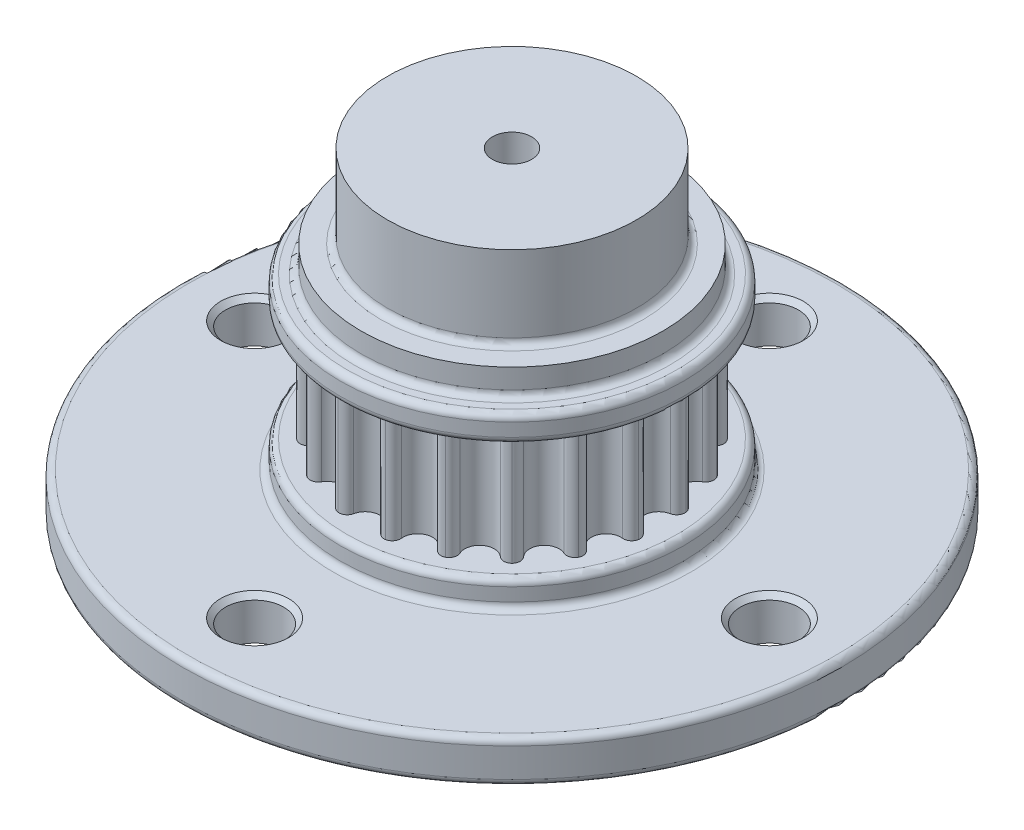
from build123d import *

# Parameters (mm, degrees)
BOSS_EXTRUDE1_DEPTH     = 3.556
CIRPATTERN1_COUNT       = 20
SKETCH9_R               = 19.84375
SKETCH9_R_2             = 1.4999999999999996
BOSS_EXTRUDE2_DEPTH     = 2.54
CUT_EXTRUDE1_DEPTH      = 30.081395842465593
CUT_EXTRUDE1_DEPTH_BACK = 30.081395842465593
SKETCH3_R               = 1.7462499999999996
SKETCH3_R_2             = 1.746249999999999
SKETCH3_R_3             = 1.7462500000000012
SKETCH3_R_4             = 1.7462499999999985
CIRPATTERN2_COUNT       = 4
CUT_EXTRUDE2_START      = -6
SKETCH11_R              = 1.5
CUT_EXTRUDE2_DEPTH      = 6
FILLET1_R               = 0.396875


with BuildPart() as part:
    # Sketch1 → Boss-Extrude1 (new, symmetric)
    with BuildSketch(Plane(origin=(0, 0, 0), x_dir=(1, 0, 0), z_dir=(0, 1, 0))):
        with BuildLine():
            ThreePointArc((0.8720606070123648, 8.659786465382457), (0.5629673031092283, 8.148255135369217), (0, 7.947579307894175))
            ThreePointArc((0, 7.947579307894175), (-1.2432753173952258, -7.8497314183622535), (2.4559370702819923, 7.558597089545281))
            ThreePointArc((2.4559370702819887, 7.558597089545281), (1.982535589248892, 7.923417606866525), (1.8466422625579257, 8.505427895318311))
            ThreePointArc((1.846642262557925, 8.505427895318311), (1.749626992044169, 8.862101959434877), (1.4341191216417435, 9.054671776489402))
            ThreePointArc((1.4341191216417435, 9.054671776489402), (1.0745459594794837, 8.96902429095141), (0.8720606070123653, 8.659786465382457))
        make_face()
    boss_extrude1 = extrude(amount=BOSS_EXTRUDE1_DEPTH, both=True)

    # CirPattern1: Boss-Extrude1 ×20 about axis
    cirpattern1_axis = Axis((0, 3.3, 0), (0, -1, 0))
    for i in range(1, CIRPATTERN1_COUNT):
        add(boss_extrude1.rotate(cirpattern1_axis, i * 360 / CIRPATTERN1_COUNT))

    # Sketch2 → Revolve3 (revolve)
    with BuildSketch(Plane(origin=(0, 0, 0), x_dir=(0, 0, -1), z_dir=(1, 0, 0))):
        Polygon((10.342329407894177, 5.087499985000001), (0, 5.087499985), (2e-16, 3.4999999849999996), (10.342329407894177, 3.499999985000001), align=None)
    revolve3 = revolve(axis=Axis((0, 3.3, 0), (0, -1, 0)))

    # Mirror1: Revolve3 across plane
    add(revolve3.mirror(Plane.ZX))

    # Sketch9 → Boss-Extrude2 (add)
    with BuildSketch(Plane.XZ.offset(5.087499985000001)):
        Circle(SKETCH9_R)
        Circle(SKETCH9_R_2, mode=Mode.SUBTRACT)
    extrude(amount=BOSS_EXTRUDE2_DEPTH)

    # Sketch3 → Cut-Extrude1 (cut, two sides: drawn at the far end of the back side and taken through both)
    with BuildSketch(Plane(origin=(0, 0, 0), x_dir=(1, 0, 0), z_dir=(0, 1, 0)).offset(-CUT_EXTRUDE1_DEPTH_BACK)):
        with Locations((-15.5, 0)):
            Circle(SKETCH3_R)
        with Locations((0, 15.500000000000002)):
            Circle(SKETCH3_R_2)
        with Locations((15.500000000000002, 0)):
            Circle(SKETCH3_R_3)
        with Locations((3.47e-15, -15.500000000000002)):
            Circle(SKETCH3_R_4)
    extrude(amount=CUT_EXTRUDE1_DEPTH + CUT_EXTRUDE1_DEPTH_BACK, mode=Mode.SUBTRACT)

    # Sketch6 → Cut-Revolve2 (revolve, cut)
    with BuildSketch(Plane.XY):
        Polygon((-11.8678, -3.499999985), (-15.5, -7.132199984999997), (-15.5, -3.499999985), align=None)
    cut_revolve2 = revolve(axis=Axis((-15.5, -7.627499985000001, 0), (0, 1, 0)), mode=Mode.SUBTRACT)

    # CirPattern2: Cut-Revolve2 ×4 about axis
    cirpattern2_axis = Axis((0, 3.3, 0), (0, -1, 0))
    for i in range(1, CIRPATTERN2_COUNT):
        add(cut_revolve2.rotate(cirpattern2_axis, i * 360 / CIRPATTERN2_COUNT), mode=Mode.SUBTRACT)

    # Sketch11 → Cut-Extrude2 (cut)
    with BuildSketch(Plane.XZ.offset(5.087499985000001).offset(CUT_EXTRUDE2_START)):
        Circle(SKETCH11_R)
    extrude(amount=CUT_EXTRUDE2_DEPTH, mode=Mode.SUBTRACT)

    # Sketch10 → Revolve4 (revolve)
    with BuildSketch(Plane(origin=(0, 0, 0), x_dir=(0, 0, -1), z_dir=(1, 0, 0))):
        Polygon((1.1821750652977259, 6.674999985000001), (1.1821750652977259, 11.674999985), (7.499999999999998, 11.674999985), (7.499999999999999, 6.674999985000001), (9.087499999999999, 6.674999985000001), (9.087500000000002, 5.087499985000001), (1.182175065297726, 5.087499985000001), align=None)
    revolve(axis=Axis((0, 0, 0), (0, 1, 0)))

    # Fillet1
    fillet1_edges = [part.edges().sort_by_distance(p)[0] for p in [
        (1.27e-15, 5.087499985000001, 10.342329407894177),
        (1.27e-15, 3.499999985000001, 10.342329407894177),
        (-19.84375, -7.627499985000001, 2.43e-15),
        (-19.84375, -5.087499985000001, 2.43e-15),
        (-9.2e-16, 6.674999985000001, 7.499999999999999),
        (-1.11e-15, 5.087499985000001, 9.087500000000002),
        (1.27e-15, -3.499999985000001, 10.342329407894177),
        (1.27e-15, -5.087499985000001, 10.342329407894177),
    ]]
    fillet(fillet1_edges, radius=FILLET1_R)


solid = part.part
